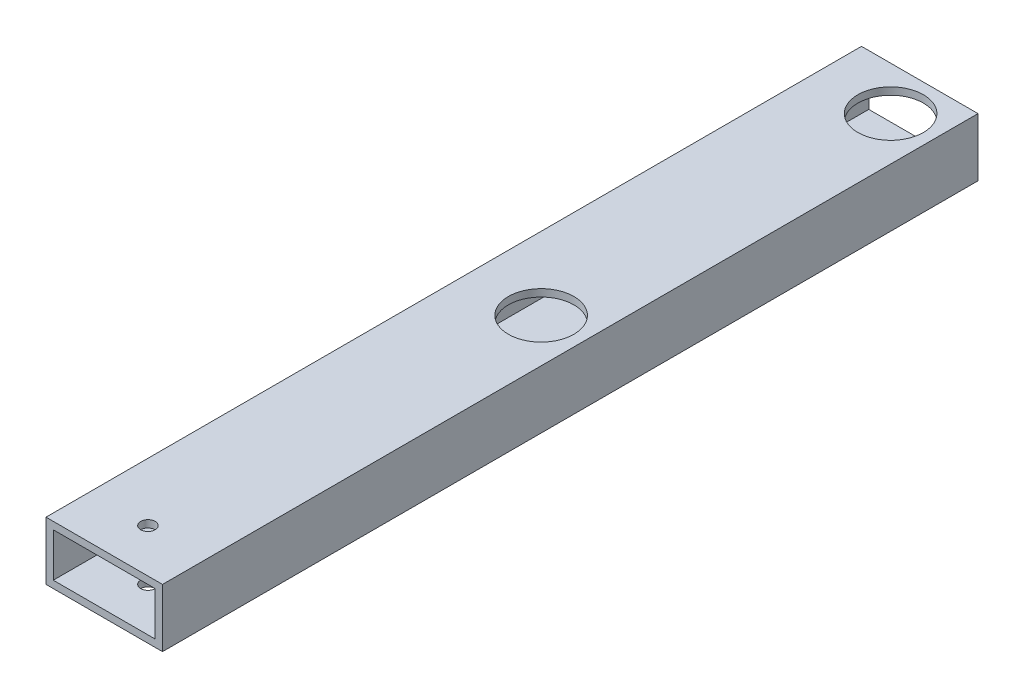
from build123d import *

# Parameters (mm, degrees)
SKETCH1_W           = 50.8
SKETCH1_H           = 25.4
SKETCH1_W_2         = 44.45
SKETCH1_H_2         = 19.05
BOSS_EXTRUDE1_DEPTH = 355.6
SKETCH2_R           = 14.2875
CUT_EXTRUDE1_DEPTH  = 361.10715072
SKETCH3_R           = 3.175
CUT_EXTRUDE2_DEPTH  = 361.10715072


with BuildPart() as part:
    # Sketch1 → Boss-Extrude1 (new body)
    with BuildSketch(Plane.XY):
        with Locations((25.4, 12.7)):
            Rectangle(SKETCH1_W, SKETCH1_H)
        with Locations((25.4, 12.7)):
            Rectangle(SKETCH1_W_2, SKETCH1_H_2, mode=Mode.SUBTRACT)
    extrude(amount=BOSS_EXTRUDE1_DEPTH)

    # Sketch2 → Cut-Extrude1 (cut, through all)
    with BuildSketch(Plane(origin=(0, 25.4, 0), x_dir=(1, 0, 0), z_dir=(0, 1, 0))):
        with Locations((31.75, -19.05)):
            Circle(SKETCH2_R)
        with Locations((31.75, -171.45)):
            Circle(SKETCH2_R)
    extrude(amount=-CUT_EXTRUDE1_DEPTH, mode=Mode.SUBTRACT)

    # Sketch3 → Cut-Extrude2 (cut, through all)
    with BuildSketch(Plane(origin=(0, 25.4, 0), x_dir=(1, 0, 0), z_dir=(0, 1, 0))):
        with Locations((25.4, -336.55)):
            Circle(SKETCH3_R)
    extrude(amount=-CUT_EXTRUDE2_DEPTH, mode=Mode.SUBTRACT)


solid = part.part
